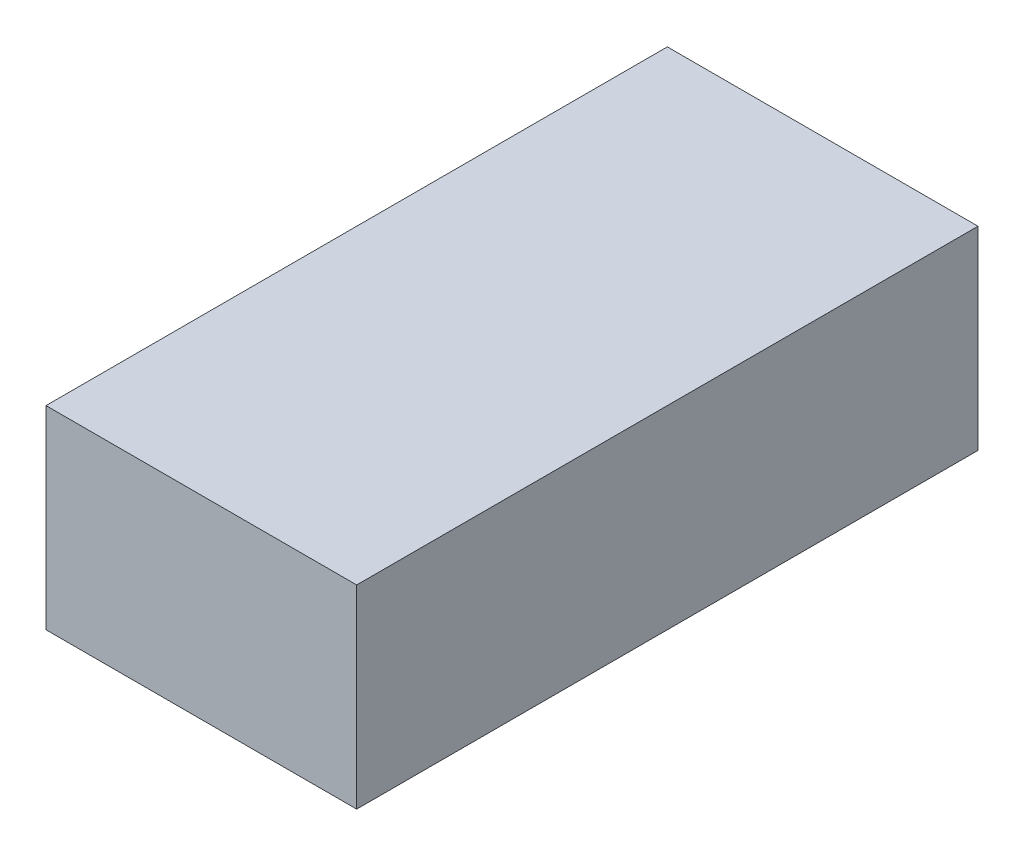
from build123d import *

# Parameters (mm, degrees)
SKETCH1_W           = 80
SKETCH1_H           = 50
BOSS_EXTRUDE1_DEPTH = 160


with BuildPart() as part:
    # Sketch1 → Boss-Extrude1 (new body)
    with BuildSketch(Plane.XY):
        with Locations((-40, 25)):
            Rectangle(SKETCH1_W, SKETCH1_H)
    extrude(amount=BOSS_EXTRUDE1_DEPTH)


solid = part.part
